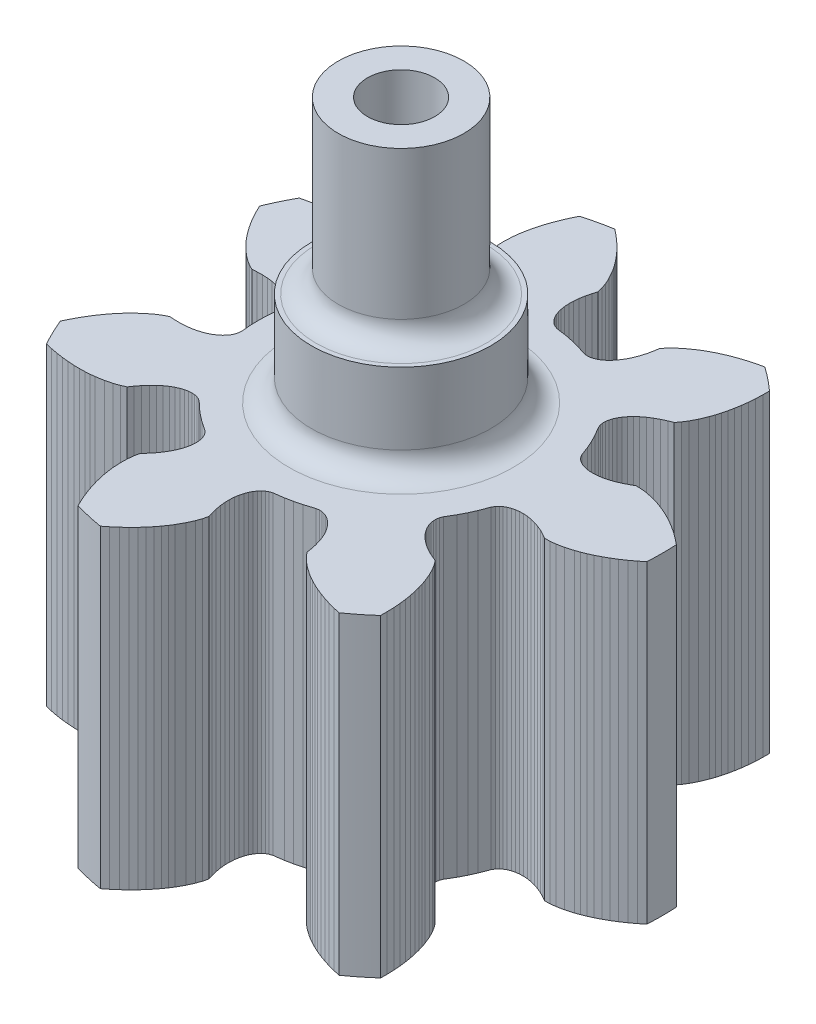
from build123d import *

# Parameters (mm, degrees)
SKETCH1_R           = 2
BOSS_EXTRUDE1_DEPTH = 2.1
SKETCH2_R           = 1.4
BOSS_EXTRUDE3_DEPTH = 3.8
BOSS_EXTRUDE4_DEPTH = 7
SKETCH3_R           = 0.75
CUT_EXTRUDE1_DEPTH  = 11.758401256
SKETCH3_3_R         = 1.1
SKETCH3_3_R_2       = 0.75
CUT_EXTRUDE2_DEPTH  = 11.758401256
FILLET1_R           = 0.5
CHAMFER1_SIZE       = 0.4


with BuildPart() as part:
    # Sketch1 → Boss-Extrude1 (new body)
    with BuildSketch(Plane(origin=(0, 0, 0), x_dir=(1, 0, 0), z_dir=(0, 1, 0))):
        with Locations(Location((0, 0, 0), (0, 0, 270))):
            Circle(SKETCH1_R)
    extrude(amount=BOSS_EXTRUDE1_DEPTH)

    # Sketch2 → Boss-Extrude3 (add)
    with BuildSketch(Plane(origin=(0, 2.1, 0), x_dir=(1, 0, 0), z_dir=(0, 1, 0))):
        with Locations(Location((0, 0, 0), (0, 0, 90))):
            Circle(SKETCH2_R)
    extrude(amount=BOSS_EXTRUDE3_DEPTH)

    # Sketch4 → Boss-Extrude4 (add)
    with BuildSketch(Plane.XZ):
        with BuildLine():
            Line((-1.677656104, -5.457545802), (-1.740166904, -5.314388502))
            Line((-1.740166904, -5.314388502), (-1.793915704, -5.175673402))
            Line((-1.793915704, -5.175673402), (-1.839244704, -5.042342702))
            Line((-1.839244704, -5.042342702), (-1.876421604, -4.915999102))
            Line((-1.876421604, -4.915999102), (-1.907053904, -4.793237402))
            Line((-1.907053904, -4.793237402), (-1.931099704, -4.676009702))
            Line((-1.931099704, -4.676009702), (-1.948773704, -4.566830802))
            Line((-1.948773704, -4.566830802), (-1.961024804, -4.464035702))
            Line((-1.961024804, -4.464035702), (-1.971502404, -4.279785302))
            Line((-1.971502404, -4.279785302), (-1.967365804, -4.124635702))
            Line((-1.967365804, -4.124635702), (-1.953730504, -4.000928102))
            Line((-1.953730504, -4.000928102), (-1.930260404, -3.886700602))
            Line((-1.930260404, -3.886700602), (-1.859391804, -3.809735002))
            Line((-1.859391804, -3.809735002), (-1.778417204, -3.712510502))
            Line((-1.778417204, -3.712510502), (-1.708697804, -3.615493902))
            Line((-1.708697804, -3.615493902), (-1.650076104, -3.519450202))
            Line((-1.650076104, -3.519450202), (-1.602332404, -3.425130202))
            Line((-1.602332404, -3.425130202), (-1.565200104, -3.333258302))
            Line((-1.565200104, -3.333258302), (-1.538382904, -3.244569502))
            Line((-1.538382904, -3.244569502), (-1.521548504, -3.159737902))
            Line((-1.521548504, -3.159737902), (-1.514299404, -3.079451802))
            Line((-1.514299404, -3.079451802), (-1.516222204, -3.004347502))
            Line((-1.516222204, -3.004347502), (-1.526863004, -2.935043002))
            Line((-1.526863004, -2.935043002), (-1.545721204, -2.872129302))
            Line((-1.545721204, -2.872129302), (-1.572279104, -2.816160102))
            Line((-1.572279104, -2.816160102), (-1.605971904, -2.767662302))
            Line((-1.605971904, -2.767662302), (-1.657232504, -2.718290402))
            Line((-1.657232504, -2.718290402), (-1.844744204, -2.592775302))
            Line((-1.844744204, -2.592775302), (-1.984007204, -2.487817902))
            Line((-1.984007204, -2.487817902), (-2.117322004, -2.375401802))
            Line((-2.117322004, -2.375401802), (-2.281415504, -2.220521102))
            Line((-2.281415504, -2.220521102), (-2.340956004, -2.181532002))
            Line((-2.340956004, -2.181532002), (-2.395735304, -2.159475702))
            Line((-2.395735304, -2.159475702), (-2.456210904, -2.146038102))
            Line((-2.456210904, -2.146038102), (-2.521743604, -2.141652302))
            Line((-2.521743604, -2.141652302), (-2.591678304, -2.146699902))
            Line((-2.591678304, -2.146699902), (-2.665327304, -2.161537602))
            Line((-2.665327304, -2.161537602), (-2.741987504, -2.186470302))
            Line((-2.741987504, -2.186470302), (-2.820946104, -2.221759402))
            Line((-2.820946104, -2.221759402), (-2.901443904, -2.267639402))
            Line((-2.901443904, -2.267639402), (-2.982749704, -2.324284202))
            Line((-2.982749704, -2.324284202), (-3.064080904, -2.391819002))
            Line((-3.064080904, -2.391819002), (-3.144672004, -2.470342602))
            Line((-3.144672004, -2.470342602), (-3.223742204, -2.559902302))
            Line((-3.223742204, -2.559902302), (-3.300510504, -2.660481102))
            Line((-3.300510504, -2.660481102), (-3.359776704, -2.746699402))
            Line((-3.359776704, -2.746699402), (-3.465917704, -2.794999002))
            Line((-3.465917704, -2.794999002), (-3.583489604, -2.835820002))
            Line((-3.583489604, -2.835820002), (-3.733828804, -2.874377002))
            Line((-3.733828804, -2.874377002), (-3.915791104, -2.905161502))
            Line((-3.915791104, -2.905161502), (-4.018735004, -2.916091602))
            Line((-4.018735004, -2.916091602), (-4.129109504, -2.923155402))
            Line((-4.129109504, -2.923155402), (-4.248748704, -2.925798102))
            Line((-4.248748704, -2.925798102), (-4.375248804, -2.923250802))
            Line((-4.375248804, -2.923250802), (-4.506697404, -2.915120202))
            Line((-4.506697404, -2.915120202), (-4.646771904, -2.900596502))
            Line((-4.646771904, -2.900596502), (-4.793969404, -2.879062302))
            Line((-4.793969404, -2.879062302), (-4.947447304, -2.849974302))
            Line((-4.947447304, -2.849974302), (-5.090225304, -2.816749202))
            ThreePointArc((-5.090225304, -2.816749202), (-5.241476502, -2.524161997), (-5.375926806, -2.223483907))
            Line((-5.375926806, -2.223483907), (-5.312882596, -2.091140098))
            Line((-5.312882596, -2.091140098), (-5.239932596, -1.953010098))
            Line((-5.239932596, -1.953010098), (-5.164992596, -1.824500098))
            Line((-5.164992596, -1.824500098), (-5.089012596, -1.705930098))
            Line((-5.089012596, -1.705930098), (-5.013412596, -1.598090098))
            Line((-5.013412596, -1.598090098), (-4.936532596, -1.497600098))
            Line((-4.936532596, -1.497600098), (-4.859872596, -1.405710098))
            Line((-4.859872596, -1.405710098), (-4.785532596, -1.323820098))
            Line((-4.785532596, -1.323820098), (-4.712802596, -1.250150098))
            Line((-4.712802596, -1.250150098), (-4.575282596, -1.127080098))
            Line((-4.575282596, -1.127080098), (-4.451402596, -1.033580098))
            Line((-4.451402596, -1.033580098), (-4.346182596, -0.967110098))
            Line((-4.346182596, -0.967110098), (-4.242242596, -0.914240098))
            Line((-4.242242596, -0.914240098), (-4.137882596, -0.921660098))
            Line((-4.137882596, -0.921660098), (-4.011382596, -0.924350098))
            Line((-4.011382596, -0.924350098), (-3.892062596, -0.918370098))
            Line((-3.892062596, -0.918370098), (-3.780422596, -0.904320098))
            Line((-3.780422596, -0.904320098), (-3.676912596, -0.882840098))
            Line((-3.676912596, -0.882840098), (-3.581932596, -0.854590098))
            Line((-3.581932596, -0.854590098), (-3.495872596, -0.820260098))
            Line((-3.495872596, -0.820260098), (-3.419052596, -0.780530098))
            Line((-3.419052596, -0.780530098), (-3.351762596, -0.736140098))
            Line((-3.351762596, -0.736140098), (-3.294242596, -0.687810098))
            Line((-3.294242596, -0.687810098), (-3.246692596, -0.636280098))
            Line((-3.246692596, -0.636280098), (-3.209262596, -0.582310098))
            Line((-3.209262596, -0.582310098), (-3.182062596, -0.526650098))
            Line((-3.182062596, -0.526650098), (-3.165152596, -0.470070098))
            Line((-3.165152596, -0.470070098), (-3.158512596, -0.399210098))
            Line((-3.158512596, -0.399210098), (-3.177292596, -0.174350098))
            Line((-3.177292596, -0.174350098), (-3.182062596, -3.0098e-05))
            Line((-3.182062596, -3.0098e-05), (-3.177292596, 0.174289902))
            Line((-3.177292596, 0.174289902), (-3.158512596, 0.399149902))
            Line((-3.158512596, 0.399149902), (-3.165152596, 0.470009902))
            Line((-3.165152596, 0.470009902), (-3.182062596, 0.526589902))
            Line((-3.182062596, 0.526589902), (-3.209262596, 0.582249902))
            Line((-3.209262596, 0.582249902), (-3.246692596, 0.636219902))
            Line((-3.246692596, 0.636219902), (-3.294242596, 0.687749902))
            Line((-3.294242596, 0.687749902), (-3.351762596, 0.736079902))
            Line((-3.351762596, 0.736079902), (-3.419052596, 0.780469902))
            Line((-3.419052596, 0.780469902), (-3.495872596, 0.820199902))
            Line((-3.495872596, 0.820199902), (-3.581932596, 0.854529902))
            Line((-3.581932596, 0.854529902), (-3.676912596, 0.882779902))
            Line((-3.676912596, 0.882779902), (-3.780422596, 0.904259902))
            Line((-3.780422596, 0.904259902), (-3.892062596, 0.918309902))
            Line((-3.892062596, 0.918309902), (-4.011382596, 0.924289902))
            Line((-4.011382596, 0.924289902), (-4.137882596, 0.921599902))
            Line((-4.137882596, 0.921599902), (-4.242242596, 0.914179902))
            Line((-4.242242596, 0.914179902), (-4.346182596, 0.967049902))
            Line((-4.346182596, 0.967049902), (-4.451402596, 1.033519902))
            Line((-4.451402596, 1.033519902), (-4.575282596, 1.127019902))
            Line((-4.575282596, 1.127019902), (-4.712802596, 1.250089902))
            Line((-4.712802596, 1.250089902), (-4.785532596, 1.323759902))
            Line((-4.785532596, 1.323759902), (-4.859872596, 1.405649902))
            Line((-4.859872596, 1.405649902), (-4.936532596, 1.497539902))
            Line((-4.936532596, 1.497539902), (-5.013412596, 1.598029902))
            Line((-5.013412596, 1.598029902), (-5.089012596, 1.705869902))
            Line((-5.089012596, 1.705869902), (-5.164992596, 1.824439902))
            Line((-5.164992596, 1.824439902), (-5.239932596, 1.952949902))
            Line((-5.239932596, 1.952949902), (-5.312882596, 2.091079902))
            Line((-5.312882596, 2.091079902), (-5.375926796, 2.223423702))
            ThreePointArc((-5.375926796, 2.223423702), (-5.241476491, 2.524101771), (-5.090225294, 2.816688957))
            Line((-5.090225294, 2.816688957), (-4.947447286, 2.849914054))
            Line((-4.947447286, 2.849914054), (-4.793969386, 2.879002054))
            Line((-4.793969386, 2.879002054), (-4.646771886, 2.900536254))
            Line((-4.646771886, 2.900536254), (-4.506697386, 2.915059954))
            Line((-4.506697386, 2.915059954), (-4.375248786, 2.923190554))
            Line((-4.375248786, 2.923190554), (-4.248748686, 2.925737854))
            Line((-4.248748686, 2.925737854), (-4.129109486, 2.923095154))
            Line((-4.129109486, 2.923095154), (-4.018734986, 2.916031354))
            Line((-4.018734986, 2.916031354), (-3.915791086, 2.905101254))
            Line((-3.915791086, 2.905101254), (-3.733828786, 2.874316754))
            Line((-3.733828786, 2.874316754), (-3.583489586, 2.835759754))
            Line((-3.583489586, 2.835759754), (-3.465917686, 2.794938754))
            Line((-3.465917686, 2.794938754), (-3.359776686, 2.746639154))
            Line((-3.359776686, 2.746639154), (-3.300510486, 2.660420854))
            Line((-3.300510486, 2.660420854), (-3.223742186, 2.559842054))
            Line((-3.223742186, 2.559842054), (-3.144671986, 2.470282354))
            Line((-3.144671986, 2.470282354), (-3.064080886, 2.391758754))
            Line((-3.064080886, 2.391758754), (-2.982749686, 2.324223954))
            Line((-2.982749686, 2.324223954), (-2.901443886, 2.267579154))
            Line((-2.901443886, 2.267579154), (-2.820946086, 2.221699154))
            Line((-2.820946086, 2.221699154), (-2.741987486, 2.186410054))
            Line((-2.741987486, 2.186410054), (-2.665327286, 2.161477354))
            Line((-2.665327286, 2.161477354), (-2.591678286, 2.146639654))
            Line((-2.591678286, 2.146639654), (-2.521743586, 2.141592054))
            Line((-2.521743586, 2.141592054), (-2.456210886, 2.145977854))
            Line((-2.456210886, 2.145977854), (-2.395735286, 2.159415454))
            Line((-2.395735286, 2.159415454), (-2.340955986, 2.181471754))
            Line((-2.340955986, 2.181471754), (-2.281415486, 2.220460854))
            Line((-2.281415486, 2.220460854), (-2.117321986, 2.375341554))
            Line((-2.117321986, 2.375341554), (-1.984007186, 2.487757654))
            Line((-1.984007186, 2.487757654), (-1.844744186, 2.592715054))
            Line((-1.844744186, 2.592715054), (-1.657232486, 2.718230154))
            Line((-1.657232486, 2.718230154), (-1.605971886, 2.767602054))
            Line((-1.605971886, 2.767602054), (-1.572279086, 2.816099854))
            Line((-1.572279086, 2.816099854), (-1.545721186, 2.872069054))
            Line((-1.545721186, 2.872069054), (-1.526862986, 2.934982754))
            Line((-1.526862986, 2.934982754), (-1.516222186, 3.004287254))
            Line((-1.516222186, 3.004287254), (-1.514299386, 3.079391554))
            Line((-1.514299386, 3.079391554), (-1.521548486, 3.159677654))
            Line((-1.521548486, 3.159677654), (-1.538382886, 3.244509254))
            Line((-1.538382886, 3.244509254), (-1.565200086, 3.333198054))
            Line((-1.565200086, 3.333198054), (-1.602332386, 3.425069954))
            Line((-1.602332386, 3.425069954), (-1.650076086, 3.519389954))
            Line((-1.650076086, 3.519389954), (-1.708697786, 3.615433654))
            Line((-1.708697786, 3.615433654), (-1.778417186, 3.712450254))
            Line((-1.778417186, 3.712450254), (-1.859391786, 3.809674754))
            Line((-1.859391786, 3.809674754), (-1.930260386, 3.886640354))
            Line((-1.930260386, 3.886640354), (-1.953730486, 4.000867854))
            Line((-1.953730486, 4.000867854), (-1.967365786, 4.124575454))
            Line((-1.967365786, 4.124575454), (-1.971502386, 4.279725054))
            Line((-1.971502386, 4.279725054), (-1.961024786, 4.463975454))
            Line((-1.961024786, 4.463975454), (-1.948773686, 4.566770554))
            Line((-1.948773686, 4.566770554), (-1.931099686, 4.675949454))
            Line((-1.931099686, 4.675949454), (-1.907053886, 4.793177154))
            Line((-1.907053886, 4.793177154), (-1.876421586, 4.915938854))
            Line((-1.876421586, 4.915938854), (-1.839244686, 5.042282454))
            Line((-1.839244686, 5.042282454), (-1.793915686, 5.175613154))
            Line((-1.793915686, 5.175613154), (-1.740166886, 5.314328254))
            Line((-1.740166886, 5.314328254), (-1.677656086, 5.457485554))
            Line((-1.677656086, 5.457485554), (-1.613492886, 5.589290554))
            ThreePointArc((-1.613492886, 5.589290554), (-1.294584924, 5.671642777), (-0.971527485, 5.735814951))
            Line((-0.971527485, 5.735814951), (-0.856530379, 5.644902123))
            Line((-0.856530379, 5.644902123), (-0.738096579, 5.543044323))
            Line((-0.738096579, 5.543044323), (-0.629484279, 5.441387023))
            Line((-0.629484279, 5.441387023), (-0.530794179, 5.340927723))
            Line((-0.530794179, 5.340927723), (-0.442480579, 5.243226523))
            Line((-0.442480579, 5.243226523), (-0.361617479, 5.145912923))
            Line((-0.361617479, 5.145912923), (-0.289089779, 5.050727423))
            Line((-0.289089779, 5.050727423), (-0.225795179, 4.960029123))
            Line((-0.225795179, 4.960029123), (-0.170156179, 4.872729423))
            Line((-0.170156179, 4.872729423), (-0.080772879, 4.711271723))
            Line((-0.080772879, 4.711271723), (-0.017182979, 4.569691923))
            Line((-0.017182979, 4.569691923), (0.024206821, 4.452319023))
            Line((0.024206821, 4.452319023), (0.052622421, 4.339220423))
            Line((0.052622421, 4.339220423), (0.022166221, 4.239128023))
            Line((0.022166221, 4.239128023), (-0.008605279, 4.116398223))
            Line((-0.008605279, 4.116398223), (-0.029326379, 3.998739123))
            Line((-0.029326379, 3.998739123), (-0.040470879, 3.886771723))
            Line((-0.040470879, 3.886771723), (-0.042562579, 3.781077223))
            Line((-0.042562579, 3.781077223), (-0.036155879, 3.682192323))
            Line((-0.036155879, 3.682192323), (-0.021836779, 3.590650923))
            Line((-0.021836779, 3.590650923), (-0.000196979, 3.506916223))
            Line((-0.000196979, 3.506916223), (0.028106621, 3.431435623))
            Line((0.028106621, 3.431435623), (0.062425521, 3.364603323))
            Line((0.062425521, 3.364603323), (0.102082621, 3.306779023))
            Line((0.102082621, 3.306779023), (0.146370621, 3.258277923))
            Line((0.146370621, 3.258277923), (0.194582521, 3.219374423))
            Line((0.194582521, 3.219374423), (0.245981121, 3.190298123))
            Line((0.245981121, 3.190298123), (0.313586921, 3.168056823))
            Line((0.313586921, 3.168056823), (0.536988121, 3.136329923))
            Line((0.536988121, 3.136329923), (0.707999021, 3.102190423))
            Line((0.707999021, 3.102190423), (0.876887021, 3.058750223))
            Line((0.876887021, 3.058750223), (1.091930421, 2.990405023))
            Line((1.091930421, 2.990405023), (1.162491321, 2.981110623))
            Line((1.162491321, 2.981110623), (1.221415521, 2.985006423))
            Line((1.221415521, 2.985006423), (1.281732621, 2.999139023))
            Line((1.281732621, 2.999139023), (1.342678421, 3.023621123))
            Line((1.342678421, 3.023621123), (1.403497321, 3.058512423))
            Line((1.403497321, 3.058512423), (1.463415021, 3.103835823))
            Line((1.463415021, 3.103835823), (1.521665521, 3.159561023))
            Line((1.521665521, 3.159561023), (1.577493421, 3.225614223))
            Line((1.577493421, 3.225614223), (1.630112821, 3.301877423))
            Line((1.630112821, 3.301877423), (1.678789621, 3.388189823))
            Line((1.678789621, 3.388189823), (1.722764221, 3.484324823))
            Line((1.722764221, 3.484324823), (1.761304221, 3.590039423))
            Line((1.761304221, 3.590039423), (1.793685421, 3.705037123))
            Line((1.793685421, 3.705037123), (1.819211821, 3.828964023))
            Line((1.819211821, 3.828964023), (1.835200121, 3.932358623))
            Line((1.835200121, 3.932358623), (1.909873421, 4.021928023))
            Line((1.909873421, 4.021928023), (1.998090521, 4.109718923))
            Line((1.998090521, 4.109718923), (2.116812121, 4.209687323))
            Line((2.116812121, 4.209687323), (2.267397621, 4.316373723))
            Line((2.267397621, 4.316373723), (2.355404521, 4.370887123))
            Line((2.355404521, 4.370887123), (2.451783521, 4.425141023))
            Line((2.451783521, 4.425141023), (2.558428121, 4.479431523))
            Line((2.558428121, 4.479431523), (2.673506021, 4.532022823))
            Line((2.673506021, 4.532022823), (2.795464821, 4.581730723))
            Line((2.795464821, 4.581730723), (2.927969221, 4.629421523))
            Line((2.927969221, 4.629421523), (3.069932921, 4.673886423))
            Line((3.069932921, 4.673886423), (3.220832621, 4.714270623))
            Line((3.220832621, 4.714270623), (3.363886921, 4.746284823))
            ThreePointArc((3.363886921, 4.746284823), (3.627108363, 4.548298309), (3.878703226, 4.335732528))
            Line((3.878703226, 4.335732528), (3.879324236, 4.189141042))
            Line((3.879324236, 4.189141042), (3.873530936, 4.033038442))
            Line((3.873530936, 4.033038442), (3.861770736, 3.884739642))
            Line((3.861770736, 3.884739642), (3.844760636, 3.744945242))
            Line((3.844760636, 3.744945242), (3.823437436, 3.614983242))
            Line((3.823437436, 3.614983242), (3.797771936, 3.491087842))
            Line((3.797771936, 3.491087842), (3.768573236, 3.375036342))
            Line((3.768573236, 3.375036342), (3.737125936, 3.269001042))
            Line((3.737125936, 3.269001042), (3.703562736, 3.171070342))
            Line((3.703562736, 3.171070342), (3.633059536, 3.000520342))
            Line((3.633059536, 3.000520342), (3.562015636, 2.862530242))
            Line((3.562015636, 2.862530242), (3.496055936, 2.756989642))
            Line((3.496055936, 2.756989642), (3.425348736, 2.664257542))
            Line((3.425348736, 2.664257542), (3.328104136, 2.625662642))
            Line((3.328104136, 2.625662642), (3.212964436, 2.573199942))
            Line((3.212964436, 2.573199942), (3.108055436, 2.516041142))
            Line((3.108055436, 2.516041142), (3.013567336, 2.454943742))
            Line((3.013567336, 2.454943742), (2.929627936, 2.390679642))
            Line((2.929627936, 2.390679642), (2.856311136, 2.324016942))
            Line((2.856311136, 2.324016942), (2.793668936, 2.255746642))
            Line((2.793668936, 2.255746642), (2.741694736, 2.186620242))
            Line((2.741694736, 2.186620242), (2.700328636, 2.117430142))
            Line((2.700328636, 2.117430142), (2.669474536, 2.048929342))
            Line((2.669474536, 2.048929342), (2.648991436, 1.981871242))
            Line((2.648991436, 1.981871242), (2.638684936, 1.917005642))
            Line((2.638684936, 1.917005642), (2.638328536, 1.855056142))
            Line((2.638328536, 1.855056142), (2.647642236, 1.796742342))
            Line((2.647642236, 1.796742342), (2.672404836, 1.730018642))
            Line((2.672404836, 1.730018642), (2.786888136, 1.535575142))
            Line((2.786888136, 1.535575142), (2.866820336, 1.380587942))
            Line((2.866820336, 1.380587942), (2.938157336, 1.221461342))
            Line((2.938157336, 1.221461342), (3.018800236, 1.010721142))
            Line((3.018800236, 1.010721142), (3.055527736, 0.949759542))
            Line((3.055527736, 0.949759542), (3.095312236, 0.906119642))
            Line((3.095312236, 0.906119642), (3.143968536, 0.867773342))
            Line((3.143968536, 0.867773342), (3.201108536, 0.835388342))
            Line((3.201108536, 0.835388342), (3.266307636, 0.809592642))
            Line((3.266307636, 0.809592642), (3.339100936, 0.791005742))
            Line((3.339100936, 0.791005742), (3.418987236, 0.780207842))
            Line((3.418987236, 0.780207842), (3.505437836, 0.777743242))
            Line((3.505437836, 0.777743242), (3.597870436, 0.784153042))
            Line((3.597870436, 0.784153042), (3.695701736, 0.799910942))
            Line((3.695701736, 0.799910942), (3.798280836, 0.825469442))
            Line((3.798280836, 0.825469442), (3.904961036, 0.861249642))
            Line((3.904961036, 0.861249642), (4.015059336, 0.907632842))
            Line((4.015059336, 0.907632842), (4.127864736, 0.964942742))
            Line((4.127864736, 0.964942742), (4.218670436, 1.016908042))
            Line((4.218670436, 1.016908042), (4.335256536, 1.014371642))
            Line((4.335256536, 1.014371642), (4.458896736, 1.000137542))
            Line((4.458896736, 1.000137542), (4.611076836, 0.969646442))
            Line((4.611076836, 0.969646442), (4.788376236, 0.918431942))
            Line((4.788376236, 0.918431942), (4.885867836, 0.883613842))
            Line((4.885867836, 0.883613842), (4.988376636, 0.842088442))
            Line((4.988376636, 0.842088442), (5.097314536, 0.792559942))
            Line((5.097314536, 0.792559942), (5.210181936, 0.735378542))
            Line((5.210181936, 0.735378542), (5.325085236, 0.671019742))
            Line((5.325085236, 0.671019742), (5.444986436, 0.597158342))
            Line((5.444986436, 0.597158342), (5.568263436, 0.513890042))
            Line((5.568263436, 0.513890042), (5.693921436, 0.421091042))
            Line((5.693921436, 0.421091042), (5.808144136, 0.329207242))
            ThreePointArc((5.808144136, 0.329207242), (5.817467929, -3.016e-05), (5.808144136, -0.329267562))
            Line((5.808144136, -0.329267562), (5.693921429, -0.421151358))
            Line((5.693921429, -0.421151358), (5.568263429, -0.513950358))
            Line((5.568263429, -0.513950358), (5.444986429, -0.597218658))
            Line((5.444986429, -0.597218658), (5.325085229, -0.671080058))
            Line((5.325085229, -0.671080058), (5.210181929, -0.735438858))
            Line((5.210181929, -0.735438858), (5.097314529, -0.792620258))
            Line((5.097314529, -0.792620258), (4.988376629, -0.842148758))
            Line((4.988376629, -0.842148758), (4.885867829, -0.883674158))
            Line((4.885867829, -0.883674158), (4.788376229, -0.918492258))
            Line((4.788376229, -0.918492258), (4.611076829, -0.969706758))
            Line((4.611076829, -0.969706758), (4.458896729, -1.000197858))
            Line((4.458896729, -1.000197858), (4.335256529, -1.014431958))
            Line((4.335256529, -1.014431958), (4.218670429, -1.016968358))
            Line((4.218670429, -1.016968358), (4.127864729, -0.965003058))
            Line((4.127864729, -0.965003058), (4.015059329, -0.907693158))
            Line((4.015059329, -0.907693158), (3.904961029, -0.861309958))
            Line((3.904961029, -0.861309958), (3.798280829, -0.825529758))
            Line((3.798280829, -0.825529758), (3.695701729, -0.799971258))
            Line((3.695701729, -0.799971258), (3.597870429, -0.784213358))
            Line((3.597870429, -0.784213358), (3.505437829, -0.777803558))
            Line((3.505437829, -0.777803558), (3.418987229, -0.780268158))
            Line((3.418987229, -0.780268158), (3.339100929, -0.791066058))
            Line((3.339100929, -0.791066058), (3.266307629, -0.809652958))
            Line((3.266307629, -0.809652958), (3.201108529, -0.835448658))
            Line((3.201108529, -0.835448658), (3.143968529, -0.867833658))
            Line((3.143968529, -0.867833658), (3.095312229, -0.906179958))
            Line((3.095312229, -0.906179958), (3.055527729, -0.949819858))
            Line((3.055527729, -0.949819858), (3.018800229, -1.010781458))
            Line((3.018800229, -1.010781458), (2.938157329, -1.221521658))
            Line((2.938157329, -1.221521658), (2.866820329, -1.380648258))
            Line((2.866820329, -1.380648258), (2.786888129, -1.535635458))
            Line((2.786888129, -1.535635458), (2.672404829, -1.730078958))
            Line((2.672404829, -1.730078958), (2.647642229, -1.796802658))
            Line((2.647642229, -1.796802658), (2.638328529, -1.855116458))
            Line((2.638328529, -1.855116458), (2.638684929, -1.917065958))
            Line((2.638684929, -1.917065958), (2.648991429, -1.981931558))
            Line((2.648991429, -1.981931558), (2.669474529, -2.048989658))
            Line((2.669474529, -2.048989658), (2.700328629, -2.117490458))
            Line((2.700328629, -2.117490458), (2.741694729, -2.186680558))
            Line((2.741694729, -2.186680558), (2.793668929, -2.255806958))
            Line((2.793668929, -2.255806958), (2.856311129, -2.324077258))
            Line((2.856311129, -2.324077258), (2.929627929, -2.390739958))
            Line((2.929627929, -2.390739958), (3.013567329, -2.455004058))
            Line((3.013567329, -2.455004058), (3.108055429, -2.516101458))
            Line((3.108055429, -2.516101458), (3.212964429, -2.573260258))
            Line((3.212964429, -2.573260258), (3.328104129, -2.625722958))
            Line((3.328104129, -2.625722958), (3.425348729, -2.664317858))
            Line((3.425348729, -2.664317858), (3.496055929, -2.757049958))
            Line((3.496055929, -2.757049958), (3.562015629, -2.862590558))
            Line((3.562015629, -2.862590558), (3.633059529, -3.000580658))
            Line((3.633059529, -3.000580658), (3.703562729, -3.171130658))
            Line((3.703562729, -3.171130658), (3.737125929, -3.269061358))
            Line((3.737125929, -3.269061358), (3.768573229, -3.375096658))
            Line((3.768573229, -3.375096658), (3.797771929, -3.491148158))
            Line((3.797771929, -3.491148158), (3.823437429, -3.615043558))
            Line((3.823437429, -3.615043558), (3.844760629, -3.745005558))
            Line((3.844760629, -3.745005558), (3.861770729, -3.884799958))
            Line((3.861770729, -3.884799958), (3.873530929, -4.033098758))
            Line((3.873530929, -4.033098758), (3.879324229, -4.189201358))
            Line((3.879324229, -4.189201358), (3.878703229, -4.335792858))
            ThreePointArc((3.878703229, -4.335792858), (3.627108367, -4.548358644), (3.363886927, -4.746345161))
            Line((3.363886927, -4.746345161), (3.220832594, -4.714330914))
            Line((3.220832594, -4.714330914), (3.069932894, -4.673946714))
            Line((3.069932894, -4.673946714), (2.927969194, -4.629481814))
            Line((2.927969194, -4.629481814), (2.795464794, -4.581791014))
            Line((2.795464794, -4.581791014), (2.673505994, -4.532083114))
            Line((2.673505994, -4.532083114), (2.558428094, -4.479491814))
            Line((2.558428094, -4.479491814), (2.451783494, -4.425201314))
            Line((2.451783494, -4.425201314), (2.355404494, -4.370947414))
            Line((2.355404494, -4.370947414), (2.267397594, -4.316434014))
            Line((2.267397594, -4.316434014), (2.116812094, -4.209747614))
            Line((2.116812094, -4.209747614), (1.998090494, -4.109779214))
            Line((1.998090494, -4.109779214), (1.909873394, -4.021988314))
            Line((1.909873394, -4.021988314), (1.835200094, -3.932418914))
            Line((1.835200094, -3.932418914), (1.819211794, -3.829024314))
            Line((1.819211794, -3.829024314), (1.793685394, -3.705097414))
            Line((1.793685394, -3.705097414), (1.761304194, -3.590099714))
            Line((1.761304194, -3.590099714), (1.722764194, -3.484385114))
            Line((1.722764194, -3.484385114), (1.678789594, -3.388250114))
            Line((1.678789594, -3.388250114), (1.630112794, -3.301937714))
            Line((1.630112794, -3.301937714), (1.577493394, -3.225674514))
            Line((1.577493394, -3.225674514), (1.521665494, -3.159621314))
            Line((1.521665494, -3.159621314), (1.463414994, -3.103896114))
            Line((1.463414994, -3.103896114), (1.403497294, -3.058572714))
            Line((1.403497294, -3.058572714), (1.342678394, -3.023681414))
            Line((1.342678394, -3.023681414), (1.281732594, -2.999199314))
            Line((1.281732594, -2.999199314), (1.221415494, -2.985066714))
            Line((1.221415494, -2.985066714), (1.162491294, -2.981170914))
            Line((1.162491294, -2.981170914), (1.091930394, -2.990465314))
            Line((1.091930394, -2.990465314), (0.876886994, -3.058810514))
            Line((0.876886994, -3.058810514), (0.707998994, -3.102250714))
            Line((0.707998994, -3.102250714), (0.536988094, -3.136390214))
            Line((0.536988094, -3.136390214), (0.313586894, -3.168117114))
            Line((0.313586894, -3.168117114), (0.245981094, -3.190358414))
            Line((0.245981094, -3.190358414), (0.194582494, -3.219434714))
            Line((0.194582494, -3.219434714), (0.146370594, -3.258338214))
            Line((0.146370594, -3.258338214), (0.102082594, -3.306839314))
            Line((0.102082594, -3.306839314), (0.062425494, -3.364663614))
            Line((0.062425494, -3.364663614), (0.028106594, -3.431495914))
            Line((0.028106594, -3.431495914), (-0.000197006, -3.506976514))
            Line((-0.000197006, -3.506976514), (-0.021836806, -3.590711214))
            Line((-0.021836806, -3.590711214), (-0.036155906, -3.682252614))
            Line((-0.036155906, -3.682252614), (-0.042562606, -3.781137514))
            Line((-0.042562606, -3.781137514), (-0.040470906, -3.886832014))
            Line((-0.040470906, -3.886832014), (-0.029326406, -3.998799414))
            Line((-0.029326406, -3.998799414), (-0.008605306, -4.116458514))
            Line((-0.008605306, -4.116458514), (0.022166194, -4.239188314))
            Line((0.022166194, -4.239188314), (0.052622394, -4.339280714))
            Line((0.052622394, -4.339280714), (0.024206794, -4.452379314))
            Line((0.024206794, -4.452379314), (-0.017183006, -4.569752214))
            Line((-0.017183006, -4.569752214), (-0.080772906, -4.711332014))
            Line((-0.080772906, -4.711332014), (-0.170156206, -4.872789714))
            Line((-0.170156206, -4.872789714), (-0.225795206, -4.960089414))
            Line((-0.225795206, -4.960089414), (-0.289089806, -5.050787714))
            Line((-0.289089806, -5.050787714), (-0.361617506, -5.145973214))
            Line((-0.361617506, -5.145973214), (-0.442480606, -5.243286814))
            Line((-0.442480606, -5.243286814), (-0.530794206, -5.340988014))
            Line((-0.530794206, -5.340988014), (-0.629484306, -5.441447314))
            Line((-0.629484306, -5.441447314), (-0.738096606, -5.543104614))
            Line((-0.738096606, -5.543104614), (-0.856530406, -5.644962414))
            Line((-0.856530406, -5.644962414), (-0.971527506, -5.735875214))
            ThreePointArc((-0.971527506, -5.735875214), (-1.294584942, -5.671703035), (-1.613492901, -5.589350807))
            Line((-1.613492901, -5.589350807), (-1.677656104, -5.457545802))
        make_face()
    extrude(amount=BOSS_EXTRUDE4_DEPTH)

    # Sketch3 → Cut-Extrude1 (cut, through all)
    with BuildSketch(Plane.XZ):
        with Locations(Location((0, 0, 0), (0, 0, 270))):
            Circle(SKETCH3_R)
    extrude(amount=-CUT_EXTRUDE1_DEPTH, mode=Mode.SUBTRACT)

    # Sketch3<3> → Cut-Extrude2 (cut, through all)
    # profile 1 of 2: a face of its own
    with BuildSketch(Plane.XZ):
        with Locations(Location((0, 0, 0), (0, 0, 90))):
            Circle(SKETCH3_3_R)
        with Locations(Location((0, 0, 0), (0, 0, 270))):
            Circle(SKETCH3_3_R_2, mode=Mode.SUBTRACT)
    # profile 2 of 2: a face of its own
    with BuildSketch(Plane.XZ):
        with Locations(Location((0, 0, 0), (0, 0, 270))):
            Circle(SKETCH3_3_R_2)
    extrude(amount=CUT_EXTRUDE2_DEPTH, mode=Mode.SUBTRACT)

    # Fillet1
    fillet1_edges = [part.edges().sort_by_distance(p)[0] for p in [
        (0, 0, -2),
        (0, 2.1, 1.4),
    ]]
    fillet(fillet1_edges, radius=FILLET1_R)

    # Chamfer1
    # the kernel refuses this chamfer: 0.4 mm, written as the material it adds along each edge
    with BuildSketch(Plane(origin=(0, 0, 0), x_dir=(0, 0, 1), z_dir=(1, 0, 0))) as chamfer1_piece_1_section:
        Polygon((1.1, CHAMFER1_SIZE), (1.1 - CHAMFER1_SIZE, 0), (1.1, 0), align=None)
    chamfer1_piece_1 = revolve(axis=Axis((0, 0, 0), (0, -1, 0)), mode=Mode.PRIVATE)
    chamfer1_piece_1 = chamfer1_piece_1 - Plane(origin=(0, -0.224951362, 0), x_dir=(0, 0, -1), z_dir=(0, -1, 0)) * Cylinder(0.75, 5, mode=Mode.PRIVATE)
    add(chamfer1_piece_1)
    # the kernel refuses this chamfer: 0.4 mm, written as the material it takes off along each edge
    with BuildSketch(Plane(origin=(0, -7, 0), x_dir=(0, 0, 1), z_dir=(-1, 0, 0))) as chamfer1_2_piece_1:
        Polygon((1.1 + CHAMFER1_SIZE, 0), (1.1, CHAMFER1_SIZE), (1.1, 0), align=None)
    revolve(axis=Axis((0, -7, 0), (0, 1, 0)), mode=Mode.SUBTRACT)


solid = part.part
